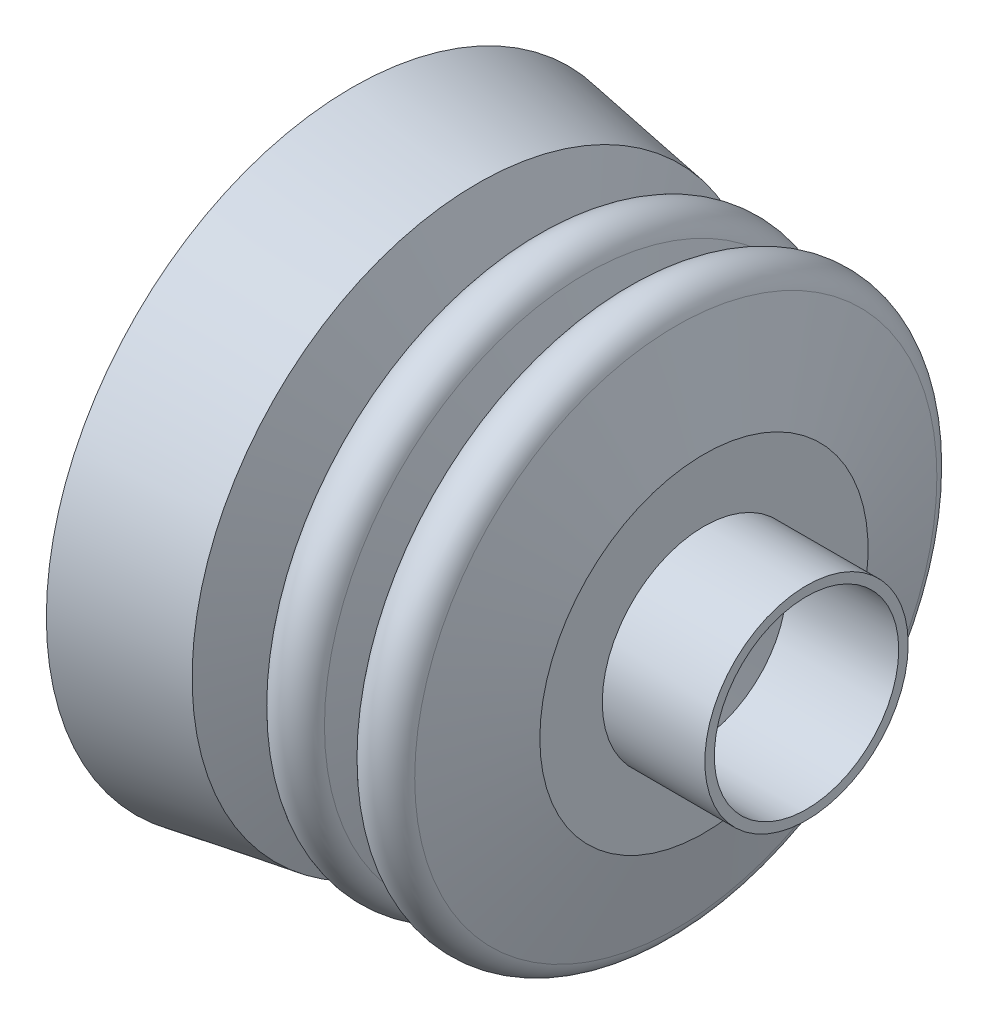
from build123d import *

# Parameters (mm, degrees)
SCALE1_SCALE = 2


# Read off the part's stored shape, not the designer's step: Thicken1
with BuildPart() as part:
    # Thicken1 outline → Thicken1 (revolve)
    with BuildSketch(Plane(origin=(0, 19.084269403, 0), x_dir=(0, 1, 0), z_dir=(0, 0, -1))):
        with BuildLine():
            Line((2.67635712, 17.996787125), (2.42635712, 17.996787125))
            Line((2.42635712, 17.996787125), (2.42635712, 15.04854118))
            Line((2.42635712, 15.04854118), (4.282985184, 15.04854118))
            Line((4.282985184, 15.04854118), (6.800464263, 14.317145896))
            ThreePointArc((6.800464263, 14.317145896), (7.142870575, 13.861103506), (6.800464263, 13.405061117))
            Line((6.800464263, 13.405061117), (4.282985184, 12.673665834))
            Line((4.282985184, 12.673665834), (6.800464263, 11.94227055))
            ThreePointArc((6.800464263, 11.94227055), (7.142870575, 11.48622816), (6.800464263, 11.030185771))
            Line((6.800464263, 11.030185771), (4.282985184, 10.298790487))
            Line((4.282985184, 10.298790487), (7.2854665, 9.15601935))
            Line((7.2854665, 9.15601935), (7.8, 6.000509818))
            Line((7.8, 6.000509818), (8.046741319, 6.040743153))
            Line((8.046741319, 6.040743153), (7.509025109, 9.338426646))
            Line((7.509025109, 9.338426646), (5.069461996, 10.2669461))
            Line((5.069461996, 10.2669461), (6.87021204, 10.79011235))
            ThreePointArc((6.87021204, 10.79011235), (7.392870575, 11.48622816), (6.87021204, 12.182343971))
            Line((6.87021204, 12.182343971), (5.179071097, 12.673665834))
            Line((5.179071097, 12.673665834), (6.87021204, 13.164987696))
            ThreePointArc((6.87021204, 13.164987696), (7.392870575, 13.861103507), (6.87021204, 14.557219317))
            Line((6.87021204, 14.557219317), (4.318565453, 15.29854118))
            Line((4.318565453, 15.29854118), (2.67635712, 15.29854118))
            Line((2.67635712, 15.29854118), (2.67635712, 17.996787125))
        make_face()
    revolve(axis=Axis((0, 19.084269403, 0), (1, 0, 0)))


with BuildPart() as part_1:
    # Scale1: scaled about (11.67199192, 19.084269403, 0)
    add(part.part.scale(SCALE1_SCALE).moved(Location((-11.67199192, -19.084269403, 0))))


solid = part_1.part
